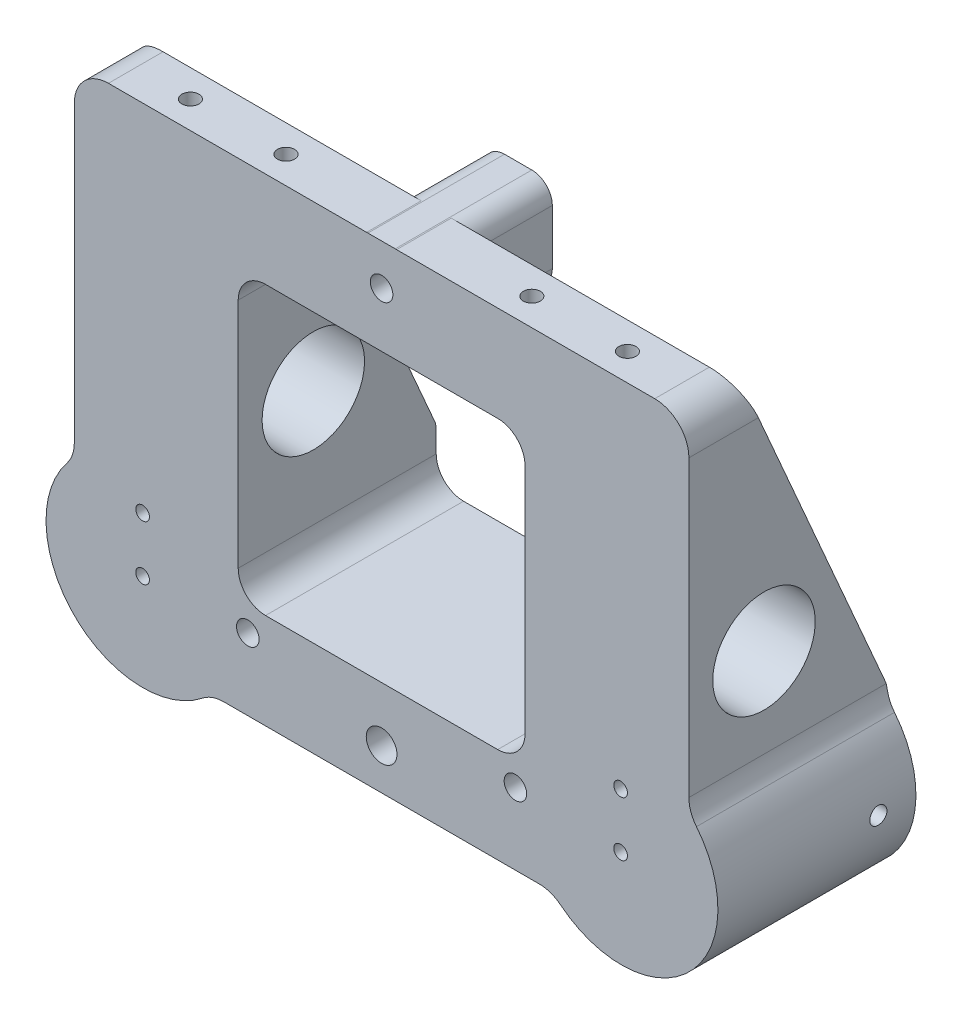
from build123d import *

# Parameters (mm, degrees)
SCHIZZO1_W                                           = 90
SCHIZZO1_H                                           = 70
ESTRUSIONE_ESTRUSIONE1_DEPTH                         = 29
SCHIZZO2_R                                           = 7.5
TAGLIO_ESTRUSIONE1_DEPTH                             = 118.64777941
FORO_LAMATO_PER_VITE_M4_A_TESTA_CILINDRI_D           = 4.5
FORO_LAMATO_PER_VITE_M4_A_TESTA_CILINDRI_CBORE_D     = 8
FORO_LAMATO_PER_VITE_M4_A_TESTA_CILINDRI_CBORE_DEPTH = 2.6
TAGLIO_ESTRUSIONE4_DEPTH                             = 118.64777941
SCHIZZO16_R                                          = 1
TAGLIO_ESTRUSIONE6_DEPTH                             = 118.64777941
SCHIZZO17_R                                          = 8
TAGLIO_ESTRUSIONE8_DEPTH                             = 13
FORO_FILETTATO_M3_1_D                                = 2.5
FORO_FILETTATO_M3_1_DEPTH                            = 12
FORO_FILETTATO_M3_1_TIP                              = 0.751075774
FORO_FILETTATO_M3_2_REACH                            = 119.648
FORO_FILETTATO_M3_2_BORE_R                           = 1.25
FORO_FILETTATO_M3_3_REACH                            = 119.648
FORO_FILETTATO_M3_3_BORE_R                           = 1.25
FORO_FILETTATO_M3_4_REACH                            = 119.648
FORO_FILETTATO_M3_4_BORE_R                           = 1.25
FORO_FILETTATO_M3_5_REACH                            = 119.648
FORO_FILETTATO_M3_5_BORE_R                           = 1.25
FORO_FILETTATO_M4_2_D                                = 3.3
FORO_FILETTATO_M4_2_DEPTH                            = 10.1
FORO_FILETTATO_M4_2_TIP                              = 0.991420021
SCHIZZO42_R                                          = 1
TAGLIO_ESTRUSIONE9_DEPTH                             = 12
TAGLIO_ESTRUSIONE10_DEPTH                            = 122
ESTRUSIONE_ESTRUSIONE5_START                         = -29
ESTRUSIONE_ESTRUSIONE5_DEPTH                         = 29
TAGLIO_ESTRUSIONE12_DEPTH                            = 122
TAGLIO_ESTRUSIONE12_DEPTH_BACK                       = 10
SCHIZZO45_R                                          = 1.25
TAGLIO_ESTRUSIONE13_DEPTH                            = 10.0001
TAGLIO_ESTRUSIONE13_DEPTH_BACK                       = 10
SCHIZZO46_R                                          = 1.25
SCHIZZO47_R                                          = 4
TAGLIO_ESTRUSIONE14_DEPTH                            = 5
TAGLIO_ESTRUSIONE15_DEPTH                            = 5
TAGLIO_ESTRUSIONE15_DEPTH_BACK                       = 5
SCHIZZO48_R                                          = 1.25
SCHIZZO50_W                                          = 10
SCHIZZO50_H                                          = 14.006473321
SCHIZZO50_R                                          = 1.65
ESTRUSIONE_ESTRUSIONE6_DEPTH                         = 20
SCHIZZO51_R                                          = 4
TAGLIO_ESTRUSIONE16_DEPTH                            = 5
SCHIZZO52_R                                          = 1.25
TAGLIO_ESTRUSIONE17_DEPTH                            = 13
RACCORDO1_R                                          = 5
RACCORDO2_R                                          = 3
RACCORDO3_R                                          = 5


with BuildPart() as part:
    # Schizzo1 → Estrusione-Estrusione1 (new body)
    with BuildSketch(Plane.XY):
        with Locations((45, 35)):
            Rectangle(SCHIZZO1_W, SCHIZZO1_H)
    extrude(amount=-ESTRUSIONE_ESTRUSIONE1_DEPTH)

    # Schizzo2 → Taglio-Estrusione1 (cut, through all)
    with BuildSketch(Plane.ZY):
        with Locations((-11, 35)):
            Circle(SCHIZZO2_R)
    extrude(amount=-TAGLIO_ESTRUSIONE1_DEPTH, mode=Mode.SUBTRACT)

    # Foro lamato per Vite M4 a testa cilindrica piana-1 (through all)
    with Locations(Plane(origin=(45, 64, -29), x_dir=(-1, 0, 0), z_dir=(0, 0, -1))):
        with Locations((0, 0), (0, -58)):
            CounterBoreHole(FORO_LAMATO_PER_VITE_M4_A_TESTA_CILINDRI_D / 2, FORO_LAMATO_PER_VITE_M4_A_TESTA_CILINDRI_CBORE_D / 2, FORO_LAMATO_PER_VITE_M4_A_TESTA_CILINDRI_CBORE_DEPTH)

    # Schizzo14 → Taglio-Estrusione4 (cut, through all)
    with BuildSketch(Plane.XY):
        with BuildLine():
            Line((62, 14), (28, 14))
            ThreePointArc((28, 14), (25.171572875, 15.171572875), (24, 18))
            Line((24, 18), (24, 52))
            ThreePointArc((24, 52), (25.171572875, 54.828427125), (28, 56))
            Line((28, 56), (62, 56))
            ThreePointArc((62, 56), (64.828427125, 54.828427125), (66, 52))
            Line((66, 52), (66, 18))
            ThreePointArc((66, 18), (64.828427125, 15.171572875), (62, 14))
        make_face()
    extrude(amount=-TAGLIO_ESTRUSIONE4_DEPTH, mode=Mode.SUBTRACT)

    # Schizzo16 → Taglio-Estrusione6 (cut, through all)
    with BuildSketch(Plane.XY):
        with Locations((10, 10)):
            Circle(SCHIZZO16_R)
        with Locations((80, 10)):
            Circle(SCHIZZO16_R)
    extrude(amount=-TAGLIO_ESTRUSIONE6_DEPTH, mode=Mode.SUBTRACT)

    # Schizzo17 → Taglio-Estrusione8 (cut)
    with BuildSketch(Plane(origin=(0, 0, -29), x_dir=(-1, 0, 0), z_dir=(0, 0, -1))):
        with Locations((-10, 10)):
            Circle(SCHIZZO17_R)
        with Locations((-80, 10)):
            Circle(SCHIZZO17_R)
    extrude(amount=-TAGLIO_ESTRUSIONE8_DEPTH, mode=Mode.SUBTRACT)

    # Foro filettato M3-1
    with Locations(Plane(origin=(0, 0, -29), x_dir=(-1, 0, 0), z_dir=(0, 0, -1))):
        with Locations((-70, 54.444444444), (-70, 15.555555556), (-20, 54.444444444), (-20, 15.555555556)):
            Hole(FORO_FILETTATO_M3_1_D / 2, depth=FORO_FILETTATO_M3_1_DEPTH)
            with Locations((0, 0, -(FORO_FILETTATO_M3_1_DEPTH + FORO_FILETTATO_M3_1_TIP / 2))):  # 118° drill point
                Cone(0, FORO_FILETTATO_M3_1_D / 2, FORO_FILETTATO_M3_1_TIP, mode=Mode.SUBTRACT)

    # Foro filettato M3-2 bore → Foro filettato M3-2 (cut, up to next)
    with BuildSketch(Plane.ZY, mode=Mode.PRIVATE) as foro_filettato_m3_2_sk1:
        with Locations((-23.5, 10)):
            Circle(FORO_FILETTATO_M3_2_BORE_R)
    foro_filettato_m3_2_tool1 = extrude(foro_filettato_m3_2_sk1.sketch, amount=-FORO_FILETTATO_M3_2_REACH, mode=Mode.PRIVATE) & part.part
    add(foro_filettato_m3_2_tool1.solids().sort_by_distance((0, 10, -23.5))[0], mode=Mode.SUBTRACT)

    # Foro filettato M3-3 bore → Foro filettato M3-3 (cut, up to next)
    with BuildSketch(Plane(origin=(0, 0, 0), x_dir=(-1, 0, 0), z_dir=(0, -1, 0)), mode=Mode.PRIVATE) as foro_filettato_m3_3_sk1:
        with Locations((-10, 23.5)):
            Circle(FORO_FILETTATO_M3_3_BORE_R)
    foro_filettato_m3_3_tool1 = extrude(foro_filettato_m3_3_sk1.sketch, amount=-FORO_FILETTATO_M3_3_REACH, mode=Mode.PRIVATE) & part.part
    add(foro_filettato_m3_3_tool1.solids().sort_by_distance((10, 0, -23.5))[0], mode=Mode.SUBTRACT)

    # Foro filettato M3-4 bore → Foro filettato M3-4 (cut, up to next)
    with BuildSketch(Plane(origin=(0, 0, 0), x_dir=(-1, 0, 0), z_dir=(0, -1, 0)), mode=Mode.PRIVATE) as foro_filettato_m3_4_sk1:
        with Locations((-80, 23.5)):
            Circle(FORO_FILETTATO_M3_4_BORE_R)
    foro_filettato_m3_4_tool1 = extrude(foro_filettato_m3_4_sk1.sketch, amount=-FORO_FILETTATO_M3_4_REACH, mode=Mode.PRIVATE) & part.part
    add(foro_filettato_m3_4_tool1.solids().sort_by_distance((80, 0, -23.5))[0], mode=Mode.SUBTRACT)

    # Foro filettato M3-5 bore → Foro filettato M3-5 (cut, up to next)
    with BuildSketch(Plane(origin=(90, 0, 0), x_dir=(0, 0, -1), z_dir=(1, 0, 0)), mode=Mode.PRIVATE) as foro_filettato_m3_5_sk1:
        with Locations((23.5, 10)):
            Circle(FORO_FILETTATO_M3_5_BORE_R)
    foro_filettato_m3_5_tool1 = extrude(foro_filettato_m3_5_sk1.sketch, amount=-FORO_FILETTATO_M3_5_REACH, mode=Mode.PRIVATE) & part.part
    add(foro_filettato_m3_5_tool1.solids().sort_by_distance((90, 10, -23.5))[0], mode=Mode.SUBTRACT)

    # Foro filettato M4-2
    with Locations(Plane.XY):
        with Locations((64.593745724, 10.5), (25.406254276, 10.5)):
            Hole(FORO_FILETTATO_M4_2_D / 2, depth=FORO_FILETTATO_M4_2_DEPTH)
            with Locations((0, 0, -(FORO_FILETTATO_M4_2_DEPTH + FORO_FILETTATO_M4_2_TIP / 2))):  # 118° drill point
                Cone(0, FORO_FILETTATO_M4_2_D / 2, FORO_FILETTATO_M4_2_TIP, mode=Mode.SUBTRACT)

    # Schizzo42 → Taglio-Estrusione9 (cut)
    with BuildSketch(Plane.XY):
        with Locations((10, 18)):
            Circle(SCHIZZO42_R)
        with Locations(Location((80, 18, 0), (0, 0, 180))):
            Circle(SCHIZZO42_R)
    extrude(amount=-TAGLIO_ESTRUSIONE9_DEPTH, mode=Mode.SUBTRACT)

    # Schizzo43 → Taglio-Estrusione10 (cut)
    with BuildSketch(Plane(origin=(90, 0, 0), x_dir=(0, 0, -1), z_dir=(1, 0, 0))):
        Polygon((7.997803753, 70), (28.877169609, 22), (62.113011897, 22), (34.666638911, 75.45129437), align=None)
    extrude(amount=-TAGLIO_ESTRUSIONE10_DEPTH, mode=Mode.SUBTRACT)

    # Estrusione-Estrusione5: read off the stored shape, not the designer's step
    # Estrusione-Estrusione5 outline → Estrusione-Estrusione5 (add)
    with BuildSketch(Plane(origin=(0, 0, -29), x_dir=(-1, 0, 0), z_dir=(0, 0, -1)).offset(ESTRUSIONE_ESTRUSIONE5_START)):
        with BuildLine():
            ThreePointArc((-90, 20), (-90.110600077, -0.109658081), (-70.000936837, 0))
            Line((-70.000936837, 0), (-90, 0))
            Line((-90, 0), (-90, 20))
        make_face()
        with BuildLine():
            ThreePointArc((-20, 0), (-10, -4.142135624), (0, 0))
            Line((0, 0), (-20, 0))
        make_face()
        with BuildLine():
            Line((0, 20), (0, 0))
            ThreePointArc((0, 0), (4.142135624, 10), (0, 20))
        make_face()
    extrude(amount=ESTRUSIONE_ESTRUSIONE5_DEPTH)

    # Schizzo45 → Taglio-Estrusione12 (cut, two sides: drawn at the far end of the back side and taken through both)
    with BuildSketch(Plane.XZ.offset(-TAGLIO_ESTRUSIONE12_DEPTH_BACK)):
        with Locations(Location((10, -23.5, 0), (0, 0, 270))):
            Circle(SCHIZZO45_R)
        with Locations(Location((80, -23.5, 0), (0, 0, 270))):
            Circle(SCHIZZO45_R)
    extrude(amount=TAGLIO_ESTRUSIONE12_DEPTH + TAGLIO_ESTRUSIONE12_DEPTH_BACK, mode=Mode.SUBTRACT)

    # Schizzo46 → Taglio-Estrusione13 (cut, two sides: drawn at the far end of the back side and taken through both)
    with BuildSketch(Plane.ZY.offset(-TAGLIO_ESTRUSIONE13_DEPTH_BACK)):
        with Locations(Location((-23.5, 10, 0), (0, 0, 180))):
            Circle(SCHIZZO46_R)
    extrude(amount=TAGLIO_ESTRUSIONE13_DEPTH + TAGLIO_ESTRUSIONE13_DEPTH_BACK, mode=Mode.SUBTRACT)

    # Schizzo47 → Taglio-Estrusione14 (cut)
    with BuildSketch(Plane(origin=(0, 0, -29), x_dir=(-1, 0, 0), z_dir=(0, 0, -1))):
        with Locations((-45, 6)):
            Circle(SCHIZZO47_R)
    extrude(amount=-TAGLIO_ESTRUSIONE14_DEPTH, mode=Mode.SUBTRACT)

    # Schizzo48 → Taglio-Estrusione15 (cut, two sides: drawn at the far end of the back side and taken through both)
    with BuildSketch(Plane(origin=(90, 0, 0), x_dir=(0, 0, -1), z_dir=(1, 0, 0)).offset(-TAGLIO_ESTRUSIONE15_DEPTH_BACK)):
        with Locations((23.5, 10)):
            Circle(SCHIZZO48_R)
    extrude(amount=TAGLIO_ESTRUSIONE15_DEPTH + TAGLIO_ESTRUSIONE15_DEPTH_BACK, mode=Mode.SUBTRACT)

    # Schizzo50 → Estrusione-Estrusione6 (add)
    with BuildSketch(Plane.XY):
        with Locations((45, 63.003236661)):
            Rectangle(SCHIZZO50_W, SCHIZZO50_H)
        with Locations((45, 64)):
            Circle(SCHIZZO50_R, mode=Mode.SUBTRACT)
    extrude(amount=-ESTRUSIONE_ESTRUSIONE6_DEPTH)

    # Schizzo51 → Taglio-Estrusione16 (cut)
    with BuildSketch(Plane(origin=(0, 0, -20), x_dir=(-1, 0, 0), z_dir=(0, 0, -1))):
        with Locations((-45, 64)):
            Circle(SCHIZZO51_R)
    extrude(amount=-TAGLIO_ESTRUSIONE16_DEPTH, mode=Mode.SUBTRACT)

    # Schizzo52 → Taglio-Estrusione17 (cut)
    with BuildSketch(Plane(origin=(0, 70, 0), x_dir=(1, 0, 0), z_dir=(0, 1, 0))):
        with Locations(Location((13, 3.998901877, 0), (0, 0, 270))):
            Circle(SCHIZZO52_R)
        with Locations(Location((27, 3.998901877, 0), (0, 0, 270))):
            Circle(SCHIZZO52_R)
        with Locations(Location((63, 3.998901877, 0), (0, 0, 270))):
            Circle(SCHIZZO52_R)
        with Locations(Location((77, 3.998901877, 0), (0, 0, 270))):
            Circle(SCHIZZO52_R)
    extrude(amount=-TAGLIO_ESTRUSIONE17_DEPTH, mode=Mode.SUBTRACT)

    # Raccordo1
    raccordo1_edges = [part.edges().sort_by_distance(p)[0] for p in [
        (90, 70, -3.998901877),
        (0, 70, -3.998901877),
        (0, 20, -14.5),
        (20, 0, -14.5),
        (90, 20, -14.5),
        (70.000936837, 0, -14.5),
    ]]
    fillet(raccordo1_edges, radius=RACCORDO1_R)

    # Raccordo2
    raccordo2_edges = [part.edges().sort_by_distance(p)[0] for p in [
        (40, 70.006473321, -10),
        (50, 70.006473321, -10),
        (50, 56, -17.043809397),
        (40, 56, -17.043809397),
    ]]
    fillet(raccordo2_edges, radius=RACCORDO2_R)

    # Raccordo3
    # the kernel refuses this fillet: 5 mm, written as the material it takes off along each edge
    with BuildSketch(Plane(origin=(63.246347194, 22, -29), x_dir=(0, -1, 0), z_dir=(1, 0, 0)), Plane(origin=(-2.753652806, 22, -29), x_dir=(0, -1, 0), z_dir=(1, 0, 0))) as raccordo3_piece_1:
        with BuildLine():
            CenterArc((1.101461123, -5), RACCORDO3_R, 90, 12.72619732)
            Line((0, -0.122830391), (0, 0))
            Line((0, 0), (1.101461123, 0))
        make_face()
    extrude(amount=29.507305613, mode=Mode.SUBTRACT)


solid = part.part
